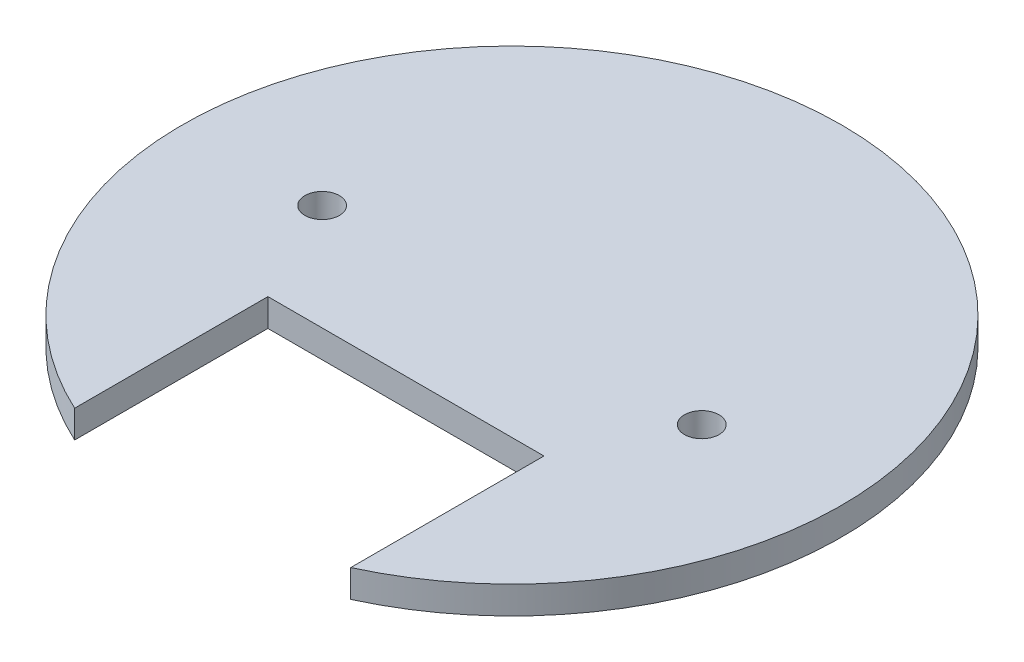
from build123d import *

# Parameters (mm, degrees)
SKETCH1_R           = 2.5
BOSS_EXTRUDE2_DEPTH = 4


with BuildPart() as part:
    # Sketch1 → Boss-Extrude2 (new body)
    with BuildSketch(Plane(origin=(0, 0, 0), x_dir=(1, 0, 0), z_dir=(0, 1, 0))):
        with BuildLine():
            Line((-20, -43.359687499), (-20, -15.359687499))
            Line((-20, -15.359687499), (20, -15.359687499))
            Line((20, -15.359687499), (20, -43.359687499))
            ThreePointArc((20, -43.359687499), (0, 47.75), (-20, -43.359687499))
        make_face()
        with Locations((-27.5, 0)):
            Circle(SKETCH1_R, mode=Mode.SUBTRACT)
        with Locations((27.5, 0)):
            Circle(SKETCH1_R, mode=Mode.SUBTRACT)
    extrude(amount=BOSS_EXTRUDE2_DEPTH)


solid = part.part
